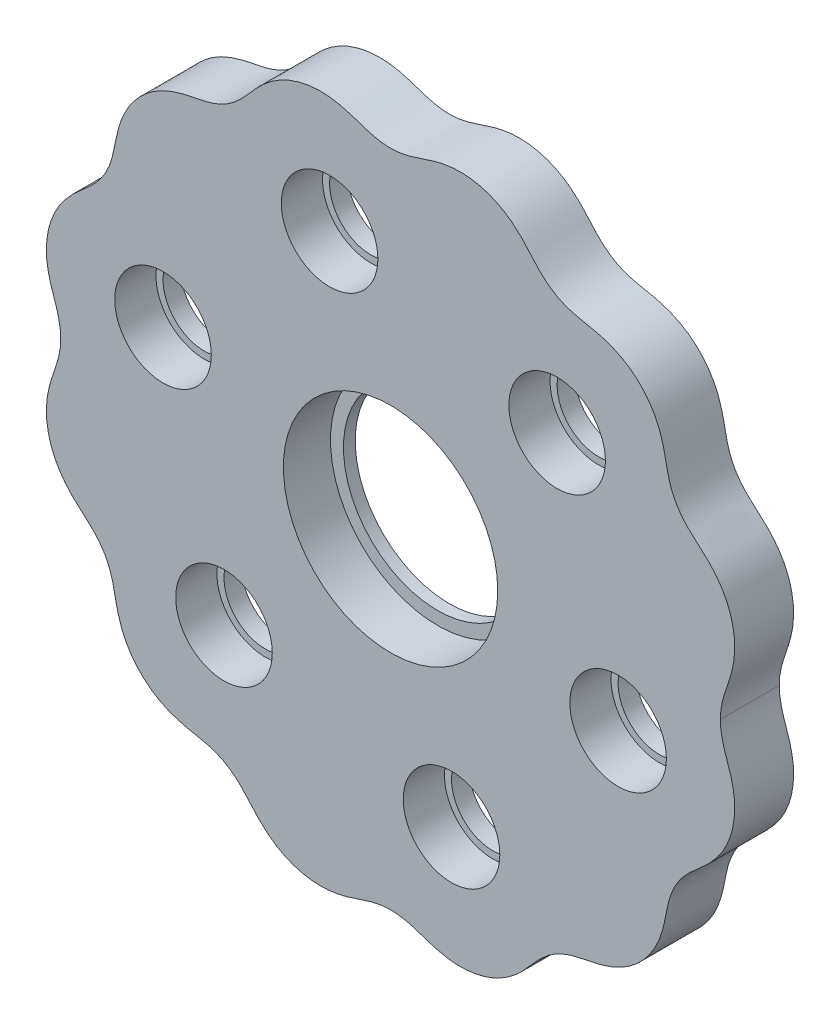
from build123d import *

# Parameters (mm, degrees)
BOSS_EXTRUDE1_DEPTH = 5
SKETCH5_R           = 9.1
CUT_EXTRUDE1_DEPTH  = 4
SKETCH6_R           = 8
CUT_EXTRUDE2_DEPTH  = 4
SKETCH7_R           = 4.1
CUT_EXTRUDE3_DEPTH  = 3.5
SKETCH8_R           = 3.5
CUT_EXTRUDE4_DEPTH  = 2.5


with BuildPart() as part:
    # Boss-Extrude1: read off the stored shape, not the designer's step
    # Boss-Extrude1 outline → Boss-Extrude1 (new body)
    with BuildSketch(Plane.XY):
        with BuildLine():
            add(Edge.make_bspline(
                [(-28, -6.29e-07), (-28.000000003, -0.02983365), (-28.000597891, -0.089626539), (-28.003288368, -0.208574631), (-28.010443823, -0.358296014), (-28.021129099, -0.497478972), (-28.035286515, -0.638042059), (-28.052838842, -0.779600747), (-28.07368907, -0.920362623), (-28.1109323, -1.137443527), (-28.172460627, -1.429714461), (-28.267823198, -1.79428308), (-28.403417207, -2.228569003), (-28.551443102, -2.662397725), (-28.701895511, -3.099170971), (-28.88092903, -3.653821492), (-29.076144869, -4.382058747), (-29.225035924, -5.293183629), (-29.242636392, -6.385132281), (-29.078888248, -7.515505435), (-28.736240754, -8.605125547), (-28.204495712, -9.664043971), (-27.50495183, -10.62095002), (-26.668353013, -11.458243252), (-25.750901936, -12.221018429), (-24.909200307, -13.01138102), (-24.212928723, -13.957224134), (-23.734598908, -15.029958866), (-23.46564848, -16.15305676), (-23.262341743, -17.343162836), (-22.955215303, -18.500998827), (-22.47025771, -19.598741792), (-21.808646094, -20.598710665), (-21.034057487, -21.438377421), (-20.135194621, -22.142557513), (-19.173070125, -22.674863767), (-18.1848113, -23.043385137), (-17.008911051, -23.330929651), (-15.816401117, -23.518551322), (-14.605437074, -23.872800143), (-13.534441757, -24.498170419), (-12.768281975, -25.16062656), (-12.124093583, -25.873424042), (-11.535815011, -26.566536844), (-10.861933868, -27.271410783), (-10.059597212, -27.93422734), (-9.125732684, -28.500446113), (-8.067203076, -28.929461856), (-6.953621623, -29.18351333), (-5.77104211, -29.258791955), (-4.591932769, -29.137476161), (-3.446910823, -28.836653139), (-2.313856017, -28.419585682), (-1.196157726, -28.077770272), (2.65e-07, -27.944508687), (1.19615809, -28.077771155), (2.313856477, -28.419584766), (3.446911017, -28.836656413), (4.591933415, -29.137472254), (5.771042166, -29.258798734), (6.953622593, -29.18350316), (8.0672025, -28.929478891), (9.125734587, -28.500416534), (10.059594746, -27.934275725), (10.861938581, -27.271326188), (11.535806076, -26.566700048), (12.124109152, -25.873139784), (12.768257554, -25.161074739), (13.534480401, -24.497470193), (14.413536978, -23.985814416), (15.369345941, -23.648151534), (16.314454966, -23.441584325), (17.223368133, -23.277357609), (18.184774521, -23.044067259), (19.173093033, -22.674454737), (20.135181499, -22.142804808), (21.034065799, -21.438231043), (21.808641528, -20.59879691), (22.470260843, -19.598684385), (22.955213046, -18.501036747), (23.262342804, -17.343137392), (23.465647405, -16.153070516), (23.734599269, -15.029950644), (24.21292871, -13.957228341), (24.909200967, -13.011377899), (25.750902477, -12.221020373), (26.668353733, -11.458242002), (27.504952345, -10.620950514), (28.204496137, -9.664043352), (28.736240977, -8.605125426), (29.078888317, -7.515504907), (29.242636266, -6.385131952), (29.225035635, -5.293183156), (29.07614444, -4.382058382), (28.880928524, -3.653821128), (28.701894972, -3.09917056), (28.551442568, -2.6623975), (28.403416705, -2.228568363), (28.26782276, -1.794283178), (28.17246026, -1.429713361), (28.110932001, -1.137443964), (28.073688824, -0.920361255), (28.052838632, -0.779602286), (28.035286341, -0.638026543), (28.022898635, -0.515108879), (28.014450689, -0.410381436), (28.007760445, -0.30225806), (28.002839903, -0.188690642), (28.000597866, -0.089619771), (27.999999995, -0.029833196), (28, -1.75e-07)],
                knots=[0.080339862, 0.080339862, 0.080339862, 0.080339862, 0.080339862, 0.08159206, 0.082844253, 0.084096446, 0.085348639, 0.086600832, 0.087853025, 0.089105218, 0.090357411, 0.09436331, 0.098369208, 0.102375107, 0.106381006, 0.110512123, 0.11464324, 0.122905474, 0.132921289, 0.142937783, 0.152954263, 0.162970812, 0.172987144, 0.184503844, 0.194518385, 0.204532926, 0.215048941, 0.225070204, 0.235586116, 0.245600673, 0.25561523, 0.267634078, 0.277649881, 0.287665956, 0.297682, 0.307697803, 0.317713803, 0.326226703, 0.334739603, 0.350259595, 0.360280295, 0.370299509, 0.37806034, 0.385821171, 0.394083001, 0.402344831, 0.41236111, 0.422377471, 0.432393848, 0.442410116, 0.452426384, 0.463943657, 0.47395909, 0.483974523, 0.494992005, 0.505008005, 0.516025487, 0.52604092, 0.536056353, 0.547573626, 0.557589894, 0.567606162, 0.577622539, 0.5876389, 0.597655179, 0.605917009, 0.614178839, 0.62193967, 0.6297005, 0.639719715, 0.649740414, 0.65750041, 0.665260407, 0.673773307, 0.682286207, 0.692302207, 0.70231801, 0.712334054, 0.722350129, 0.732365931, 0.74438478, 0.754399337, 0.764413894, 0.774929805, 0.784951069, 0.795467084, 0.805481625, 0.815496166, 0.827012865, 0.837029198, 0.847045746, 0.857062227, 0.86707872, 0.877094536, 0.88535677, 0.889487887, 0.893619004, 0.897624903, 0.901630801, 0.9056367, 0.909642599, 0.910894792, 0.912146985, 0.913399178, 0.914651371, 0.915903564, 0.91652966, 0.917155757, 0.91840795, 0.919660143, 0.919660143, 0.919660143, 0.919660143, 0.919660143], degree=4))
            add(Edge.make_bspline(
                [(28, -1.75e-07), (27.999999995, 0.029832846), (28.000597866, 0.08961942), (28.002839901, 0.188690291), (28.007760443, 0.302257709), (28.014450686, 0.410381085), (28.022898631, 0.515108529), (28.035286336, 0.638026193), (28.052838626, 0.779601936), (28.073688816, 0.920360905), (28.110931992, 1.137443615), (28.172460249, 1.429713012), (28.267822745, 1.79428283), (28.403416687, 2.228568016), (28.551442546, 2.662397154), (28.701894947, 3.099170216), (28.880928495, 3.653820785), (29.076144404, 4.38205804), (29.225035592, 5.293182815), (29.242636214, 6.385131612), (29.078888256, 7.515504565), (28.736240908, 8.605125082), (28.204496059, 9.664043003), (27.504952259, 10.62095016), (26.66835364, 11.458241641), (25.750902378, 12.221020005), (24.909200862, 13.011377523), (24.212928597, 13.95722796), (23.734599147, 15.029950259), (23.465647274, 16.153070128), (23.262342664, 17.343137003), (22.955212896, 18.501036355), (22.470260684, 19.59868399), (21.808641361, 20.598796509), (21.034065625, 21.438230636), (20.135181319, 22.142804394), (19.173092849, 22.674454315), (18.184774334, 23.044066829), (17.223367944, 23.277357171), (16.314454776, 23.44158388), (15.36934575, 23.648151081), (14.413536783, 23.985813955), (13.534480202, 24.497469725), (12.76825735, 25.161074265), (12.124108943, 25.873139305), (11.535805861, 26.566699564), (10.86193836, 27.271325699), (10.05959452, 27.934275229), (9.125734356, 28.500416031), (8.067202266, 28.929478379), (6.953622356, 29.183502639), (5.771041929, 29.258798203), (4.591933179, 29.137471714), (3.446910784, 28.836655864), (2.313856247, 28.419584208), (1.196157862, 28.077770587), (3.9e-08, 27.94450811), (-1.196157953, 28.077769684), (-2.313856247, 28.419585086), (-3.446911056, 28.836652534), (-4.591933006, 29.137475546), (-5.771042347, 29.258791331), (-6.953621859, 29.183512697), (-8.06720331, 28.929461213), (-9.125732915, 28.500445461), (-10.059597439, 27.934226681), (-10.861934089, 27.271410118), (-11.535815226, 26.566536173), (-12.124093793, 25.873423366), (-12.768282179, 25.160625879), (-13.534441956, 24.498169732), (-14.605437268, 23.872799447), (-15.816401308, 23.518550616), (-17.00891124, 23.330928936), (-18.184811486, 23.043384412), (-19.173070309, 22.674863034), (-20.135194801, 22.142556773), (-21.03405766, 21.438376673), (-21.808646261, 20.598709911), (-22.470257869, 19.598741032), (-22.955215453, 18.500998064), (-23.262341883, 17.34316207), (-23.465648611, 16.153055992), (-23.734599029, 15.029958097), (-24.212928836, 13.95722336), (-24.909200413, 13.01138024), (-25.750902035, 12.221017643), (-26.668353106, 11.458242458), (-27.504951916, 10.62094922), (-28.204495791, 9.664043165), (-28.736240824, 8.605124737), (-29.078888309, 7.515504621), (-29.242636444, 6.385131467), (-29.225035967, 5.293182814), (-29.076144904, 4.382057933), (-28.88092906, 3.653820681), (-28.701895536, 3.099170161), (-28.551443123, 2.662396917), (-28.403417225, 2.228568195), (-28.267823213, 1.794282274), (-28.172460638, 1.429713655), (-28.110932309, 1.137442722), (-28.073689077, 0.920361818), (-28.052838848, 0.779599942), (-28.03528652, 0.638041254), (-28.021129103, 0.497478168), (-28.010443826, 0.358295209), (-28.003288369, 0.208573826), (-28.000597891, 0.089625735), (-28.000000004, 0.029832846), (-28, -6.29e-07)],
                knots=[0.080339862, 0.080339862, 0.080339862, 0.080339862, 0.080339862, 0.081592055, 0.082844248, 0.083470345, 0.084096441, 0.085348634, 0.086600827, 0.08785302, 0.089105213, 0.090357406, 0.094363305, 0.098369204, 0.102375102, 0.106381001, 0.110512118, 0.114643235, 0.122905469, 0.132921285, 0.142937778, 0.152954259, 0.162970807, 0.17298714, 0.184503839, 0.19451838, 0.204532921, 0.215048936, 0.2250702, 0.235586111, 0.245600668, 0.255615225, 0.267634074, 0.277649876, 0.287665951, 0.297681995, 0.307697798, 0.317713798, 0.326226698, 0.334739598, 0.342499594, 0.350259591, 0.36028029, 0.370299504, 0.378060335, 0.385821166, 0.394082996, 0.402344826, 0.412361105, 0.422377466, 0.432393843, 0.442410111, 0.452426379, 0.463943652, 0.473959085, 0.483974518, 0.494992, 0.505008, 0.516025482, 0.526040915, 0.536056348, 0.547573621, 0.557589889, 0.567606157, 0.577622534, 0.587638895, 0.597655174, 0.605917004, 0.614178834, 0.621939665, 0.629700496, 0.63971971, 0.649740409, 0.665260402, 0.673773302, 0.682286202, 0.692302202, 0.702318005, 0.712334049, 0.722350124, 0.732365926, 0.744384775, 0.754399332, 0.764413889, 0.7749298, 0.784951064, 0.795467079, 0.80548162, 0.815496161, 0.82701286, 0.837029193, 0.847045741, 0.857062222, 0.867078715, 0.877094531, 0.885356765, 0.889487882, 0.893618999, 0.897624898, 0.901630796, 0.905636695, 0.909642594, 0.910894787, 0.91214698, 0.913399173, 0.914651366, 0.915903559, 0.917155752, 0.918407945, 0.919660143, 0.919660143, 0.919660143, 0.919660143, 0.919660143], degree=4))
        make_face()
    extrude(amount=BOSS_EXTRUDE1_DEPTH)

    # Sketch5 → Cut-Extrude1 (cut)
    with BuildSketch(Plane.XY.offset(5)):
        Circle(SKETCH5_R)
    extrude(amount=-CUT_EXTRUDE1_DEPTH, mode=Mode.SUBTRACT)

    # Sketch6 → Cut-Extrude2 (cut)
    with BuildSketch(Plane.XY.offset(1)):
        Circle(SKETCH6_R)
    extrude(amount=-CUT_EXTRUDE2_DEPTH, mode=Mode.SUBTRACT)

    # Sketch7 → Cut-Extrude3 (cut)
    with BuildSketch(Plane.XY.offset(5)):
        with Locations((-14.142288837, -14.141982409)):
            Circle(SKETCH7_R)
        with Locations((-19.318460445, 5.176590196)):
            Circle(SKETCH7_R)
        with Locations((-5.176171608, 19.318572605)):
            Circle(SKETCH7_R)
        with Locations((14.142288837, 14.141982409)):
            Circle(SKETCH7_R)
        with Locations((19.318460445, -5.176590196)):
            Circle(SKETCH7_R)
        with Locations((5.176171608, -19.318572605)):
            Circle(SKETCH7_R)
    extrude(amount=-CUT_EXTRUDE3_DEPTH, mode=Mode.SUBTRACT)

    # Sketch8 → Cut-Extrude4 (cut)
    with BuildSketch(Plane.XY.offset(1.5)):
        with Locations((-14.142288837, -14.141982409)):
            Circle(SKETCH8_R)
        with Locations((-19.318460445, 5.176590196)):
            Circle(SKETCH8_R)
        with Locations((-5.176171608, 19.318572605)):
            Circle(SKETCH8_R)
        with Locations((14.142288837, 14.141982409)):
            Circle(SKETCH8_R)
        with Locations((19.318460445, -5.176590196)):
            Circle(SKETCH8_R)
        with Locations((5.176171608, -19.318572605)):
            Circle(SKETCH8_R)
    extrude(amount=-CUT_EXTRUDE4_DEPTH, mode=Mode.SUBTRACT)


solid = part.part
